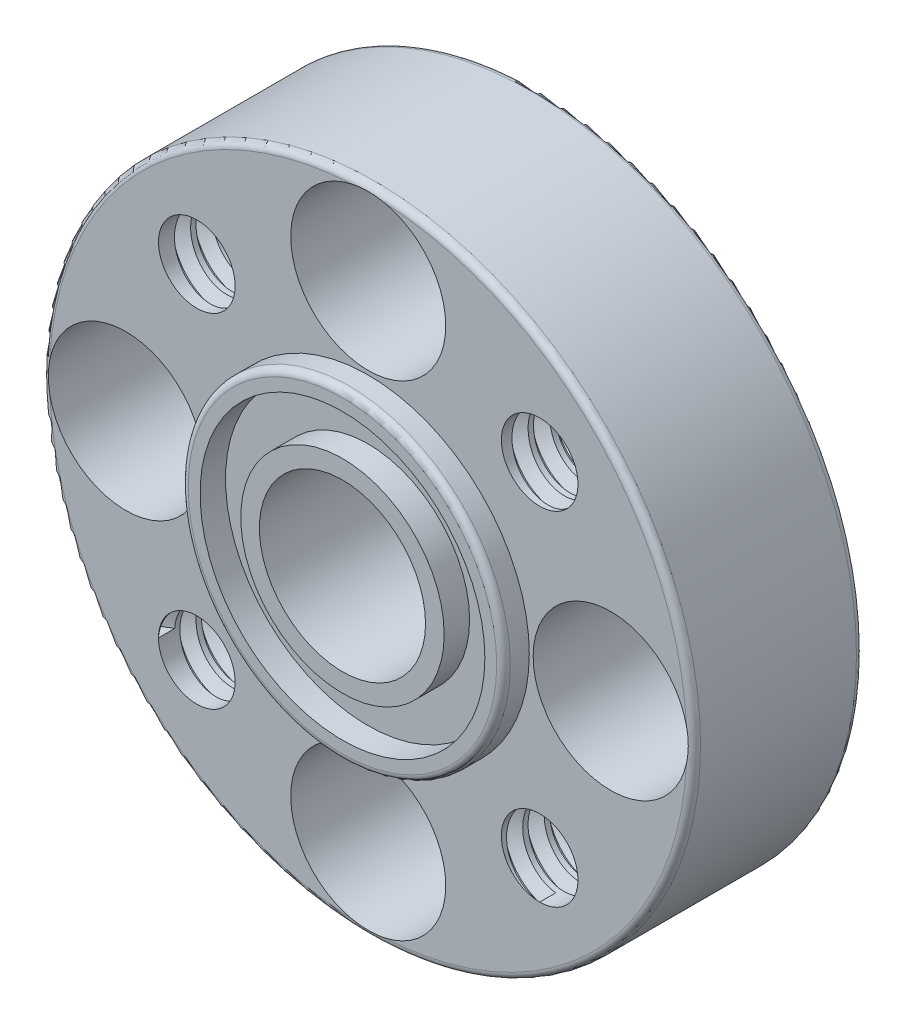
from build123d import *

# Parameters (mm, degrees)
SKETCH1_R                                           = 9.6
BOSS_EXTRUDE1_DEPTH                                 = 5
SKETCH4_R                                           = 4.75
BOSS_EXTRUDE4_DEPTH                                 = 0.76
SKETCH5_R                                           = 2.45
CUT_EXTRUDE2_DEPTH                                  = 15.747799836
SKETCH6_R                                           = 4.2
SKETCH6_R_2                                         = 3
CUT_EXTRUDE3_DEPTH                                  = 0.75
FILLET1_R                                           = 0.2
CBORE_FOR_M2_HEX_SOCKET_HEAD_CAP_SCREW1_D           = 2.4
CBORE_FOR_M2_HEX_SOCKET_HEAD_CAP_SCREW1_CBORE_D     = 4.572
CBORE_FOR_M2_HEX_SOCKET_HEAD_CAP_SCREW1_CBORE_DEPTH = 4
SKETCH9_R                                           = 1.13
CUT_EXTRUDE4_DEPTH                                  = 15.467895626
THREAD1_PITCH                                       = 0.635
CIRPATTERN1_COUNT                                   = 4


with BuildPart() as part:
    # Sketch1 → Boss-Extrude1 (new body)
    with BuildSketch(Plane.XY):
        Circle(SKETCH1_R)
    extrude(amount=BOSS_EXTRUDE1_DEPTH)

    # Sketch4 → Boss-Extrude4 (add)
    with BuildSketch(Plane.XY.offset(5)):
        Circle(SKETCH4_R)
    extrude(amount=BOSS_EXTRUDE4_DEPTH)

    # Sketch5 → Cut-Extrude2 (cut, through all)
    with BuildSketch(Plane.XY.offset(5.76)):
        Circle(SKETCH5_R)
    extrude(amount=-CUT_EXTRUDE2_DEPTH, mode=Mode.SUBTRACT)

    # Sketch6 → Cut-Extrude3 (cut)
    with BuildSketch(Plane.XY.offset(5.76)):
        Circle(SKETCH6_R)
        Circle(SKETCH6_R_2, mode=Mode.SUBTRACT)
    extrude(amount=-CUT_EXTRUDE3_DEPTH, mode=Mode.SUBTRACT)

    # Fillet1
    fillet1_edges = [part.edges().sort_by_distance(p)[0] for p in [
        (-9.6, 0, 0),
        (-9.6, 0, 5),
        (-4.75, 0, 5.76),
    ]]
    fillet(fillet1_edges, radius=FILLET1_R)

    # CBORE for M2 Hex Socket Head Cap Screw1 (through all)
    with Locations(Plane(origin=(0, -7.15, 5), x_dir=(1, 0, 0), z_dir=(0, 0, 1))):
        with Locations((0, 0)):
            cbore_for_m2_hex_socket_head_cap_screw1 = CounterBoreHole(CBORE_FOR_M2_HEX_SOCKET_HEAD_CAP_SCREW1_D / 2, CBORE_FOR_M2_HEX_SOCKET_HEAD_CAP_SCREW1_CBORE_D / 2, CBORE_FOR_M2_HEX_SOCKET_HEAD_CAP_SCREW1_CBORE_DEPTH)

    # Sketch9 → Cut-Extrude4 (cut, through all)
    with BuildSketch(Plane.XY.offset(5)):
        with Locations((-5.055813485, -5.055813485)):
            Circle(SKETCH9_R)
    cut_extrude4 = extrude(amount=-CUT_EXTRUDE4_DEPTH, mode=Mode.SUBTRACT)

    # Thread1: the profile of Thread Profile2 profile screwed along a right-hand helix of 7.874016 turns, 6 arcs to a turn; built about Z, then put on its axis
    thread1_z = Axis((0, 0, 0), (0, 0, 1))
    thread1_corners = [(1.1297, 0, -0.000173205), (1.473703831, 0, 0.198437499), (1.473703831, 0, 0.277812499), (1.1297, 0, 0.476423203)]
    with BuildLine(mode=Mode.PRIVATE) as thread1_profile:
        Line(thread1_corners[0], thread1_corners[1])
        Line(thread1_corners[1], thread1_corners[2])
        Line(thread1_corners[2], thread1_corners[3])
        Line(thread1_corners[3], thread1_corners[0])
    thread1_cap = Face(thread1_profile.wire())
    thread1_turn_angles = [0, 30, 60, 90, 120, 150, 180, 210, 240, 270, 300, 330, 360]
    thread1_turn_weights = [1, 0.8660254037844387, 1, 0.8660254037844387, 1, 0.8660254037844387, 1, 0.8660254037844387, 1, 0.8660254037844387, 1, 0.8660254037844387, 1]
    thread1_turn_rails = [Edge.make_bspline([Vector(p[0], p[1], 0).rotate(thread1_z, thread1_turn_angles[k]) / thread1_turn_weights[k] + Vector(0, 0, p[2] + THREAD1_PITCH * thread1_turn_angles[k] / 360) for k in range(13)], [0, 0, 0, 1, 1, 2, 2, 3, 3, 4, 4, 5, 5, 6, 6, 6], 2, thread1_turn_weights) for p in thread1_corners]
    thread1_turn_sides = [Face.make_surface_from_curves(thread1_turn_rails[p[0]], thread1_turn_rails[p[1]]) for p in [(0, 1), (1, 2), (2, 3), (3, 0)]]
    thread1_last_angles = [2520, 2550, 2580, 2610, 2640, 2670, 2700, 2730, 2760, 2790, 2820, 2827.322834646, 2834.645669291]
    thread1_last_weights = [1, 0.8660254037844387, 1, 0.8660254037844387, 1, 0.8660254037844387, 1, 0.8660254037844387, 1, 0.8660254037844387, 1, 0.9918437235207201, 1]
    thread1_last_rails = [Edge.make_bspline([Vector(p[0], p[1], 0).rotate(thread1_z, thread1_last_angles[k]) / thread1_last_weights[k] + Vector(0, 0, p[2] + THREAD1_PITCH * thread1_last_angles[k] / 360) for k in range(13)], [0, 0, 0, 1, 1, 2, 2, 3, 3, 4, 4, 5, 5, 6, 6, 6], 2, thread1_last_weights) for p in thread1_corners]
    thread1_last_sides = [Face.make_surface_from_curves(thread1_last_rails[p[0]], thread1_last_rails[p[1]]) for p in [(0, 1), (1, 2), (2, 3), (3, 0)]]
    thread1 = Plane(origin=(-5.055813485, -5.055813485, 5), x_dir=(-1, 0, 0), z_dir=(0, 0, -1)) * Solid(Shell([*[p.moved(Location((0, 0, THREAD1_PITCH * i))) for i in range(7) for p in thread1_turn_sides], *thread1_last_sides, thread1_cap, thread1_cap.rotate(thread1_z, 2834.645669291).moved(Location((0, 0, THREAD1_PITCH * 2834.645669291 / 360)))]))
    add(thread1, mode=Mode.SUBTRACT)

    # CirPattern1: CBORE for M2 Hex Socket Head Cap Screw1, Cut-Extrude4, Thread1 ×4 about axis
    cirpattern1_axis = Axis((0, 0, 6.394387537), (0, 0, -1))
    add([cbore_for_m2_hex_socket_head_cap_screw1.rotate(cirpattern1_axis, i * 360 / CIRPATTERN1_COUNT) for i in range(1, CIRPATTERN1_COUNT)], mode=Mode.SUBTRACT)
    add([cut_extrude4.rotate(cirpattern1_axis, i * 360 / CIRPATTERN1_COUNT) for i in range(1, CIRPATTERN1_COUNT)], mode=Mode.SUBTRACT)
    add([thread1.rotate(cirpattern1_axis, i * 360 / CIRPATTERN1_COUNT) for i in range(1, CIRPATTERN1_COUNT)], mode=Mode.SUBTRACT)


solid = part.part
